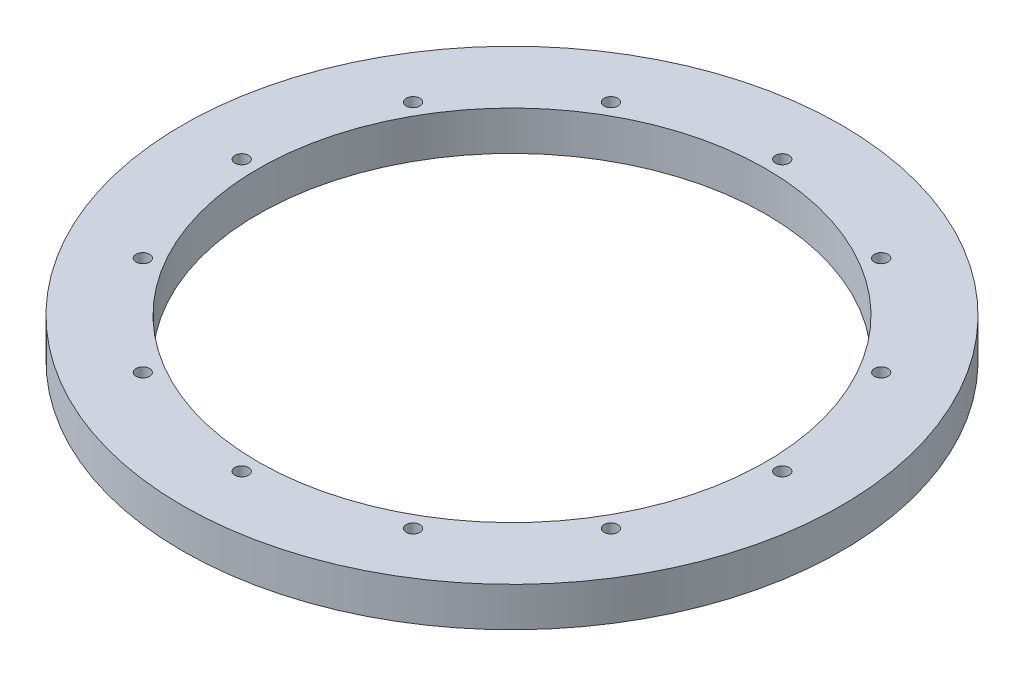
from build123d import *

# Parameters (mm, degrees)
SKETCH1_R           = 63.881
SKETCH1_R_2         = 1.3208
SKETCH1_R_3         = 49.2125
BOSS_EXTRUDE1_DEPTH = 7.62


with BuildPart() as part:
    # Sketch1 → Boss-Extrude1 (new body)
    with BuildSketch(Plane(origin=(0, 0, 0), x_dir=(1, 0, 0), z_dir=(0, 1, 0))):
        Circle(SKETCH1_R)
        with Locations((0, -52.3875)):
            Circle(SKETCH1_R_2, mode=Mode.SUBTRACT)
        with Locations((-26.19375, -45.368905841)):
            Circle(SKETCH1_R_2, mode=Mode.SUBTRACT)
        with Locations((-45.368905841, -26.19375)):
            Circle(SKETCH1_R_2, mode=Mode.SUBTRACT)
        Circle(SKETCH1_R_3, mode=Mode.SUBTRACT)
        with Locations((26.19375, -45.368905841)):
            Circle(SKETCH1_R_2, mode=Mode.SUBTRACT)
        with Locations((45.368905841, -26.19375)):
            Circle(SKETCH1_R_2, mode=Mode.SUBTRACT)
        with Locations((52.3875, 0)):
            Circle(SKETCH1_R_2, mode=Mode.SUBTRACT)
        with Locations((-52.3875, 0)):
            Circle(SKETCH1_R_2, mode=Mode.SUBTRACT)
        with Locations((-45.368905841, 26.19375)):
            Circle(SKETCH1_R_2, mode=Mode.SUBTRACT)
        with Locations((-26.19375, 45.368905841)):
            Circle(SKETCH1_R_2, mode=Mode.SUBTRACT)
        with Locations((45.368905841, 26.19375)):
            Circle(SKETCH1_R_2, mode=Mode.SUBTRACT)
        with Locations((26.19375, 45.368905841)):
            Circle(SKETCH1_R_2, mode=Mode.SUBTRACT)
        with Locations((0, 52.3875)):
            Circle(SKETCH1_R_2, mode=Mode.SUBTRACT)
    extrude(amount=BOSS_EXTRUDE1_DEPTH)


solid = part.part
